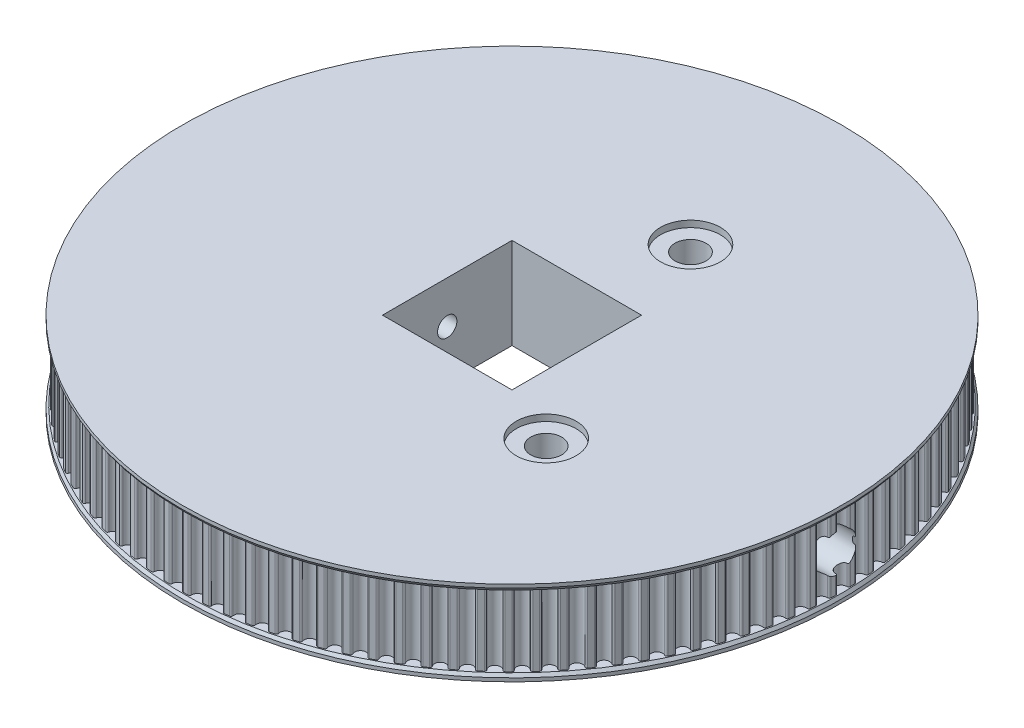
from build123d import *

# Parameters (mm, degrees)
BOSS_EXTRUDE1_DEPTH     = 11
SKETCH2_W               = 19.9
SKETCH2_H               = 19.9
CUT_EXTRUDE1_DEPTH      = 21
SKETCH3_R               = 50.63
SKETCH3_W               = 19.9
SKETCH3_H               = 19.9
BOSS_EXTRUDE3_DEPTH     = 1
BOSS_EXTRUDE4_START     = 1
SKETCH4_R               = 50.63
SKETCH4_W               = 19.9
SKETCH4_H               = 19.9
BOSS_EXTRUDE4_DEPTH     = 1
CUT_EXTRUDE2_DEPTH      = 88
CUT_EXTRUDE2_DEPTH_BACK = 65
SKETCH5_R               = 1.48
CHAMFER1_SIZE           = 0.3
CHAMFER1_SIZE2          = 0.461959489
CHAMFER2_SIZE           = 0.3
CHAMFER2_SIZE2          = 0.461959489
CUT_EXTRUDE3_START      = -8
SKETCH6_R               = 2.9
CUT_EXTRUDE3_DEPTH      = 61
CUT_EXTRUDE6_START      = -8
CUT_EXTRUDE6_DEPTH      = 61
SKETCH8_R               = 2.38
CUT_EXTRUDE7_DEPTH      = 62
SKETCH9_R               = 4.6
CUT_EXTRUDE8_DEPTH      = 1
SKETCH11_R              = 16
SKETCH11_W              = 19.9
SKETCH11_H              = 19.9
BOSS_EXTRUDE5_DEPTH     = 1


with BuildPart() as part:
    # Sketch1 → Boss-Extrude1 (new body)
    with BuildSketch(Plane(origin=(0, 0, 0), x_dir=(1, 0, 0), z_dir=(0, 1, 0))):
        with BuildLine():
            ThreePointArc((0, 48.956307929), (0.624559434, 49.220646709), (0.869589491, 49.853030887))
            ThreePointArc((0.869589491, 49.853030887), (0.944878496, 50.044121275), (1.135354899, 50.120950377))
            ThreePointArc((1.135354899, 50.120950377), (1.499776235, 50.111369655), (1.864118272, 50.099139319))
            ThreePointArc((1.864118272, 50.099139319), (2.049659046, 50.011056451), (2.113385295, 49.815805495))
            ThreePointArc((2.113385295, 49.815805495), (2.320157579, 49.169899387), (2.927790576, 48.868682491))
            ThreePointArc((2.927790576, 48.868682491), (3.567040687, 49.09519689), (3.849451373, 49.711795367))
            ThreePointArc((3.849451373, 49.711795367), (3.936033619, 49.898041133), (4.130763793, 49.963341441))
            ThreePointArc((4.130763793, 49.963341441), (4.493959895, 49.931983958), (4.856918382, 49.897986345))
            ThreePointArc((4.856918382, 49.897986345), (5.036859341, 49.798965025), (5.08879471, 49.600252448))
            ThreePointArc((5.08879471, 49.600252448), (5.256569031, 48.943136587), (5.845100422, 48.606119852))
            ThreePointArc((5.845100422, 48.606119852), (6.49675286, 48.793999008), (6.815533217, 49.392604522))
            ThreePointArc((6.815533217, 49.392604522), (6.913098763, 49.573338954), (7.111385625, 49.62687671))
            ThreePointArc((7.111385625, 49.62687671), (7.472056346, 49.573854716), (7.832331985, 49.51821153))
            ThreePointArc((7.832331985, 49.51821153), (8.006028988, 49.408606228), (8.045987561, 49.20714337))
            ThreePointArc((8.045987561, 49.20714337), (8.174163329, 48.54117006), (8.741486325, 48.16955992))
            ThreePointArc((8.741486325, 48.16955992), (9.403208343, 48.318131274), (9.757217222, 48.896600972))
            ThreePointArc((9.757217222, 48.896600972), (9.865416808, 49.071177088), (10.066550542, 49.11276064))
            ThreePointArc((10.066550542, 49.11276064), (10.423404774, 49.038263942), (10.779707873, 48.96117437))
            ThreePointArc((10.779707873, 48.96117437), (10.946539128, 48.841377445), (10.974377865, 48.63788549))
            ThreePointArc((10.974377865, 48.63788549), (11.062496245, 47.965438743), (11.606579975, 47.560565465))
            ThreePointArc((11.606579975, 47.560565465), (12.276002782, 47.66929717), (12.663972921, 48.22556028))
            ThreePointArc((12.663972921, 48.22556028), (12.782419221, 48.393353143), (12.985679821, 48.422833633))
            ThreePointArc((12.985679821, 48.422833633), (13.337440118, 48.327128909), (13.688495204, 48.228868912))
            ThreePointArc((13.688495204, 48.228868912), (13.847863499, 48.099309206), (13.863482744, 47.894516604))
            ThreePointArc((13.863482744, 47.894516604), (13.911228295, 47.218003603), (14.430125082, 46.781316529))
            ThreePointArc((14.430125082, 46.781316529), (15.104852316, 46.849819354), (15.525394884, 47.381884599))
            ThreePointArc((15.525394884, 47.381884599), (15.653663891, 47.542293554), (15.858323736, 47.55956545))
            ThreePointArc((15.858323736, 47.55956545), (16.203730888, 47.442995297), (16.548281275, 47.323916621))
            ThreePointArc((16.548281275, 47.323916621), (16.699616112, 47.185057924), (16.702959953, 46.979697778))
            ThreePointArc((16.702959953, 46.979697778), (16.710161758, 46.301540266), (17.202014086, 45.834602621))
            ThreePointArc((17.202014086, 45.834602621), (17.8796304, 45.862631343), (18.331239963, 46.368594069))
            ThreePointArc((18.331239963, 46.368594069), (18.468872506, 46.521044893), (18.674198968, 46.526046365))
            ThreePointArc((18.674198968, 46.526046365), (19.012016506, 46.389028076), (19.348828794, 46.24955699))
            ThreePointArc((19.348828794, 46.24955699), (19.491588435, 46.10189638), (19.4826449, 45.896703827))
            ThreePointArc((19.4826449, 45.896703827), (19.449277179, 45.219329431), (19.912324344, 44.723812732))
            ThreePointArc((19.912324344, 44.723812732), (20.590404046, 44.711267016), (21.07146396, 45.189316006))
            ThreePointArc((21.07146396, 45.189316006), (21.217967352, 45.333262965), (21.423225415, 45.32597611))
            ThreePointArc((21.423225415, 45.32597611), (21.75224404, 45.169000174), (22.080112527, 45.009635949))
            ThreePointArc((22.080112527, 45.009635949), (22.213785929, 44.853702013), (22.192587035, 44.649411588))
            ThreePointArc((22.192587035, 44.649411588), (22.118769235, 43.975245133), (22.551353649, 43.4529232))
            ThreePointArc((22.551353649, 43.4529232), (23.227469391, 43.399847957), (23.736257585, 43.84827192))
            ThreePointArc((23.736257585, 43.84827192), (23.891107381, 43.983199721), (24.095562274, 43.963650624))
            ThreePointArc((24.095562274, 43.963650624), (24.414604186, 43.787278973), (24.732355188, 43.608592093))
            ThreePointArc((24.732355188, 43.608592093), (24.856463835, 43.444943034), (24.823085469, 43.242286044))
            ThreePointArc((24.823085469, 43.242286044), (24.709081838, 42.57374087), (25.109654961, 42.026483481))
            ThreePointArc((25.109654961, 42.026483481), (25.781386423, 41.933068705), (26.316081568, 42.3502624))
            ThreePointArc((26.316081568, 42.3502624), (26.478723446, 42.475688037), (26.681643275, 42.443946679))
            ThreePointArc((26.681643275, 42.443946679), (26.989566386, 42.248810679), (27.296062437, 42.051440795))
            ThreePointArc((27.296062437, 42.051440795), (27.410162052, 41.880662434), (27.364723698, 41.680364339))
            ThreePointArc((27.364723698, 41.680364339), (27.210942341, 41.019833665), (27.578070225, 40.449599858))
            ThreePointArc((27.578070225, 40.449599858), (28.243012783, 40.316179951), (28.801700809, 40.700649933))
            ThreePointArc((28.801700809, 40.700649933), (28.971552553, 40.816124415), (29.172210917, 40.77230442))
            ThreePointArc((29.172210917, 40.77230442), (29.467912942, 40.559102607), (29.762056866, 40.343756253))
            ThreePointArc((29.762056866, 40.343756253), (29.865739002, 40.166459932), (29.808403319, 39.969237747))
            ThreePointArc((29.808403319, 39.969237747), (29.615394732, 39.319086101), (29.947763155, 38.727917166))
            ThreePointArc((29.947763155, 38.727917166), (30.603536488, 38.554969737), (31.184217437, 38.905339702))
            ThreePointArc((31.184217437, 38.905339702), (31.360671022, 39.01044966), (31.558349615, 38.954707893))
            ThreePointArc((31.558349615, 38.954707893), (31.840772018, 38.724203475), (32.121510856, 38.491651534))
            ThreePointArc((32.121510856, 38.491651534), (32.214404358, 38.308471928), (32.145376593, 38.115031657))
            ThreePointArc((32.145376593, 38.115031657), (31.913831697, 37.477586413), (32.210250866, 36.867598582))
            ThreePointArc((32.210250866, 36.867598582), (32.854507474, 36.655742737), (33.455102659, 36.970758453))
            ThreePointArc((33.455102659, 36.970758453), (33.637526427, 37.065127619), (33.831517612, 36.997663623))
            ThreePointArc((33.831517612, 36.997663623), (34.099649394, 36.750681744), (34.365978174, 36.501756692))
            ThreePointArc((34.365978174, 36.501756692), (34.447750507, 36.313349537), (34.367277761, 36.124383646))
            ThreePointArc((34.367277761, 36.124383646), (34.098025427, 35.501926693), (34.357434238, 34.875303564))
            ThreePointArc((34.357434238, 34.875303564), (34.987867851, 34.625297691), (35.606227297, 34.903831483))
            ThreePointArc((35.606227297, 34.903831483), (35.793968218, 34.987122042), (35.983577557, 34.908177318))
            ThreePointArc((35.983577557, 34.908177318), (36.236458875, 34.645602111), (36.487424209, 34.381195035))
            ThreePointArc((36.487424209, 34.381195035), (36.55778265, 34.188234779), (36.466152994, 34.004419717))
            ThreePointArc((36.466152994, 34.004419717), (36.160157076, 33.399179289), (36.381626912, 32.75816401))
            ThreePointArc((36.381626912, 32.75816401), (36.995980741, 32.470903066), (37.629890882, 32.711957855))
            ThreePointArc((37.629890882, 32.711957855), (37.822276892, 32.783871648), (38.006825633, 32.693728799))
            ThreePointArc((38.006825633, 32.693728799), (38.243551238, 32.416500214), (38.478254735, 32.137557623))
            ThreePointArc((38.478254735, 32.137557623), (38.536947419, 31.940735014), (38.434488864, 31.762728791))
            ThreePointArc((38.434488864, 31.762728791), (38.092844747, 31.176871492), (38.275582804, 30.52375873))
            ThreePointArc((38.275582804, 30.52375873), (38.871657622, 30.200271036), (39.518849224, 30.402983909))
            ThreePointArc((39.518849224, 30.402983909), (39.715191632, 30.463263502), (39.894019137, 30.362245216))
            ThreePointArc((39.894019137, 30.362245216), (40.113741614, 30.07135566), (40.331343096, 29.778876096))
            ThreePointArc((40.331343096, 29.778876096), (40.378159918, 29.578895707), (40.265239239, 29.407335539))
            ThreePointArc((40.265239239, 29.407335539), (39.88916992, 28.842958587), (40.032522044, 28.180086317))
            ThreePointArc((40.032522044, 28.180086317), (40.608184058, 27.821529873), (41.266340342, 27.98517517))
            ThreePointArc((41.266340342, 27.98517517), (41.465936293, 28.03360478), (41.638402407, 27.922072675))
            ThreePointArc((41.638402407, 27.922072675), (41.840335205, 27.618563457), (42.040055716, 27.313593921))
            ThreePointArc((42.040055716, 27.313593921), (42.074829084, 27.11117163), (41.951850508, 26.946671659))
            ThreePointArc((41.951850508, 26.946671659), (41.542702218, 26.405795375), (41.646155245, 25.735536508))
            ThreePointArc((41.646155245, 25.735536508), (42.199343733, 25.343194854), (42.866108672, 25.467186767))
            ThreePointArc((42.866108672, 25.467186767), (43.068243664, 25.503593027), (43.233731003, 25.381946361))
            ThreePointArc((43.233731003, 25.381946361), (43.417151255, 25.066903965), (43.598275847, 24.750536168))
            ThreePointArc((43.598275847, 24.750536168), (43.620881281, 24.546396595), (43.488285039, 24.389545687))
            ThreePointArc((43.488285039, 24.389545687), (43.047522424, 23.874106269), (43.110706019, 23.198860158))
            ThreePointArc((43.110706019, 23.198860158), (43.639440711, 22.774137775), (44.312427458, 22.858032446))
            ThreePointArc((44.312427458, 22.858032446), (44.5163779, 22.882285031), (44.674294062, 22.750959266))
            ThreePointArc((44.674294062, 22.750959266), (44.838545172, 22.425511462), (45.000425467, 22.09887792))
            ThreePointArc((45.000425467, 22.09887792), (45.010782045, 21.893751831), (44.869042797, 21.745111472))
            ThreePointArc((44.869042797, 21.745111472), (44.398243671, 21.256954059), (44.420931653, 20.579137909))
            ThreePointArc((44.420931653, 20.579137909), (44.923319816, 20.123555194), (45.600119254, 20.167052301))
            ThreePointArc((45.600119254, 20.167052301), (45.805155057, 20.179064393), (45.954934743, 20.038529642))
            ThreePointArc((45.954934743, 20.038529642), (46.099428735, 19.703841448), (46.241485242, 19.368111424))
            ThreePointArc((46.241485242, 19.368111424), (46.239555891, 19.162733118), (46.089181027, 19.022835402))
            ThreePointArc((46.089181027, 19.022835402), (45.590030729, 18.56370747), (45.572141882, 17.885747688))
            ThreePointArc((45.572141882, 17.885747688), (46.046385096, 17.400935507), (46.724574459, 17.403879342))
            ThreePointArc((46.724574459, 17.403879342), (46.929961647, 17.403607942), (47.071068685, 17.254367283))
            ThreePointArc((47.071068685, 17.254367283), (47.195288307, 16.911636796), (47.317012501, 16.568012116))
            ThreePointArc((47.317012501, 16.568012116), (47.302804128, 16.363116794), (47.144331951, 16.232462517))
            ThreePointArc((47.144331951, 16.232462517), (46.61861731, 15.804007627), (46.56021567, 15.128331132))
            ThreePointArc((46.56021567, 15.128331132), (47.004616268, 14.616024988), (47.681767813, 14.578405013))
            ThreePointArc((47.681767813, 14.578405013), (47.886771154, 14.565851091), (48.018700418, 14.408438766))
            ThreePointArc((48.018700418, 14.408438766), (48.122200995, 14.058892874), (48.223157136, 13.708603624))
            ThreePointArc((48.223157136, 13.708603624), (48.196720603, 13.504924758), (48.030718402, 13.38398163))
            ThreePointArc((48.030718402, 13.38398163), (47.48032134, 12.987733538), (47.38161597, 12.316759077))
            ThreePointArc((47.38161597, 12.316759077), (47.794583113, 11.778792892), (48.468272814, 11.700743777))
            ThreePointArc((48.468272814, 11.700743777), (48.672158449, 11.675952274), (48.794437665, 11.510931778))
            ThreePointArc((48.794437665, 11.510931778), (48.876848694, 11.155821763), (48.956675384, 10.800121889))
            ThreePointArc((48.956675384, 10.800121889), (48.918105326, 10.598388597), (48.745167347, 10.487589563))
            ThreePointArc((48.745167347, 10.487589563), (48.172058142, 10.124966733), (48.033402382, 9.461096221))
            ThreePointArc((48.033402382, 9.461096221), (48.413457755, 8.899395775), (49.081273977, 8.781196915))
            ThreePointArc((49.081273977, 8.781196915), (49.283312049, 8.744256578), (49.39550349, 8.572218643))
            ThreePointArc((49.39550349, 8.572218643), (49.45652996, 8.212815706), (49.51494144, 7.852978521))
            ThreePointArc((49.51494144, 7.852978521), (49.464375929, 7.653912955), (49.285121243, 7.553654646))
            ThreePointArc((49.285121243, 7.553654646), (48.691351478, 7.225955176), (48.513241679, 6.571565096))
            ThreePointArc((48.513241679, 6.571565096), (48.859024783, 5.988141131), (49.518576918, 5.830215648))
            ThreePointArc((49.518576918, 5.830215648), (49.718044182, 5.781258713), (49.819746232, 5.602819189))
            ThreePointArc((49.819746232, 5.602819189), (49.859169684, 5.240409901), (49.895956857, 4.877723528))
            ThreePointArc((49.895956857, 4.877723528), (49.833576904, 4.682038291), (49.648647197, 4.592679607))
            ThreePointArc((49.648647197, 4.592679607), (49.036342413, 4.301076574), (48.819416163, 3.658509473))
            ThreePointArc((48.819416163, 3.658509473), (49.129689183, 3.055450496), (49.778616205, 2.858363721))
            ThreePointArc((49.778616205, 2.858363721), (49.974798621, 2.797565442), (50.065647212, 2.613363096))
            ThreePointArc((50.065647212, 2.613363096), (50.083326521, 2.249244788), (50.098357698, 1.885007551))
            ThreePointArc((50.098357698, 1.885007551), (50.024386607, 1.693403145), (49.83444388, 1.615263966))
            ThreePointArc((49.83444388, 1.615263966), (49.205795969, 1.360801235), (48.950829807, 0.732357336))
            ThreePointArc((48.950829807, 0.732357336), (49.224482047, 0.111822141), (49.860460966, -0.123720406))
            ThreePointArc((49.860460966, -0.123720406), (50.052656251, -0.196142387), (50.13232617, -0.385448158))
            ThreePointArc((50.13232617, -0.385448158), (50.128198047, -0.749972038), (50.12141942, -1.114456264))
            ThreePointArc((50.12141942, -1.114456264), (50.036121988, -1.301293944), (49.841846187, -1.367933901))
            ThreePointArc((49.841846187, -1.367933901), (49.199105546, -1.58434542), (48.907012185, -2.19641645))
            ThreePointArc((48.907012185, -2.19641645), (49.14306404, -2.832206509), (49.763818217, -3.105361646))
            ThreePointArc((49.763818217, -3.105361646), (49.951338362, -3.189148078), (50.019544411, -3.382879608))
            ThreePointArc((50.019544411, -3.382879608), (49.993623634, -3.746504158), (49.96505947, -4.109930615))
            ThreePointArc((49.96505947, -4.109930615), (49.86874104, -4.291332739), (49.670827621, -4.346234919))
            ThreePointArc((49.670827621, -4.346234919), (49.016295094, -4.523820529), (48.688120152, -5.117327635))
            ThreePointArc((48.688120152, -5.117327635), (48.885726619, -5.766096594), (49.489033914, -6.075886497))
            ThreePointArc((49.489033914, -6.075886497), (49.671207645, -6.170737446), (49.727705664, -6.368201226))
            ThreePointArc((49.727705664, -6.368201226), (49.680085024, -6.729624766), (49.629837574, -7.090692481))
            ThreePointArc((49.629837574, -7.090692481), (49.522842941, -7.266009677), (49.322000383, -7.308977544))
            ThreePointArc((49.322000383, -7.308977544), (48.658019027, -7.447101535), (48.294937285, -8.019920116))
            ThreePointArc((48.294937285, -8.019920116), (48.453390983, -8.679345549), (49.037091714, -9.024661251))
            ThreePointArc((49.037091714, -9.024661251), (49.213266897, -9.130237175), (49.257854638, -9.330726337))
            ThreePointArc((49.257854638, -9.330726337), (49.188704603, -9.688655064), (49.11695374, -10.046071508))
            ThreePointArc((49.11695374, -10.046071508), (48.999665917, -10.214676185), (48.796613184, -10.245555926))
            ThreePointArc((48.796613184, -10.245555926), (48.125559881, -10.343723851), (47.728871077, -10.893803363))
            ThreePointArc((47.728871077, -10.893803363), (47.847604784, -11.561524701), (48.409609453, -11.941130061))
            ThreePointArc((48.409609453, -11.941130061), (48.579155426, -12.057053025), (48.611673276, -12.25984987))
            ThreePointArc((48.611673276, -12.25984987), (48.521241386, -12.613002491), (48.42824396, -12.965488206))
            ThreePointArc((48.42824396, -12.965488206), (48.301082807, -13.126776804), (48.096546775, -13.145457878))
            ThreePointArc((48.096546775, -13.145457878), (47.42082372, -13.203318319), (46.991947899, -13.728689623))
            ThreePointArc((46.991947899, -13.728689623), (47.070536577, -14.402316594), (47.608833353, -14.814852724))
            ThreePointArc((47.608833353, -14.814852724), (47.771143187, -14.940707754), (47.79147474, -15.145086321))
            ThreePointArc((47.79147474, -15.145086321), (47.680084718, -15.492198643), (47.566173635, -15.838491822))
            ThreePointArc((47.566173635, -15.838491822), (47.429594356, -15.991886969), (47.224307211, -15.998302501))
            ThreePointArc((47.224307211, -15.998302501), (46.546333318, -16.015648335), (46.086805742, -16.514430736))
            ThreePointArc((46.086805742, -16.514430736), (46.124968066, -17.191551932), (46.637629987, -17.635542059))
            ThreePointArc((46.637629987, -17.635542059), (46.792122653, -17.770878628), (46.800195128, -17.976107295))
            ThreePointArc((46.800195128, -17.976107295), (46.668245721, -18.315936744), (46.533828754, -18.654797748))
            ThreePointArc((46.533828754, -18.654797748), (46.388320266, -18.799750329), (46.183016884, -18.793877354))
            ThreePointArc((46.183016884, -18.793877354), (45.505219123, -18.770646486), (45.016684782, -19.241054474))
            ThreePointArc((45.016684782, -19.241054474), (45.014284141, -19.919245976), (45.499476009, -20.39310073))
            ThreePointArc((45.499476009, -20.39310073), (45.645598464, -20.537434367), (45.641382964, -20.74277847))
            ThreePointArc((45.641382964, -20.74277847), (45.489346516, -21.074108546), (45.334904842, -21.404324339))
            ThreePointArc((45.334904842, -21.404324339), (45.18098803, -21.540315462), (44.976403342, -21.522175004))
            ThreePointArc((44.976403342, -21.522175004), (44.301208054, -21.458450594), (43.785415775, -21.89880023))
            ThreePointArc((43.785415775, -21.89880023), (43.742460761, -22.575634289), (44.198445716, -23.077657394))
            ThreePointArc((44.198445716, -23.077657394), (44.33567488, -23.230471422), (44.319186494, -23.435195881))
            ThreePointArc((44.319186494, -23.435195881), (44.147607257, -23.756840508), (43.973693738, -24.077229004))
            ThreePointArc((43.973693738, -24.077229004), (43.811919583, -24.203771856), (43.608785949, -24.173428853))
            ThreePointArc((43.608785949, -24.173428853), (42.938610158, -24.069439019), (42.397406342, -24.478153965))
            ThreePointArc((42.397406342, -24.478153965), (42.314050724, -25.151207691), (42.739196458, -25.679602034))
            ThreePointArc((42.739196458, -25.679602034), (42.867041086, -25.840349419), (42.838338839, -26.043721373))
            ThreePointArc((42.838338839, -26.043721373), (42.647831022, -26.354529147), (42.455068223, -26.663943438))
            ThreePointArc((42.455068223, -26.663943438), (42.286015834, -26.780585029), (42.085060421, -26.738148101))
            ThreePointArc((42.085060421, -26.738148101), (41.422303181, -26.594265098), (40.857625199, -26.969882261))
            ThreePointArc((40.857625199, -26.969882261), (40.734167367, -27.636746296), (41.126951969, -28.189620363))
            ThreePointArc((41.126951969, -28.189620363), (41.244954411, -28.357725671), (41.204141049, -28.559017102))
            ThreePointArc((41.204141049, -28.559017102), (40.995386621, -28.857875412), (40.784464582, -29.155207876))
            ThreePointArc((40.784464582, -29.155207876), (40.608739123, -29.261530657), (40.410681299, -29.207151717))
            ThreePointArc((40.410681299, -29.207151717), (39.75771511, -29.023890611), (39.171584361, -29.365065379))
            ThreePointArc((39.171584361, -29.365065379), (39.008466264, -30.023352523), (39.367483666, -30.598727168))
            ThreePointArc((39.367483666, -30.598727168), (39.475221503, -30.773588625), (39.422443129, -30.972078962))
            ThreePointArc((39.422443129, -30.972078962), (39.196189375, -31.257917972), (38.967863142, -31.542104235))
            ThreePointArc((38.967863142, -31.542104235), (38.786093666, -31.637727601), (38.591642426, -31.571601311))
            ThreePointArc((38.591642426, -31.571601311), (37.950804737, -31.349618128), (37.345319418, -31.655129184))
            ThreePointArc((37.345319418, -31.655129184), (37.143124975, -32.302482939), (37.467089989, -32.89829847))
            ThreePointArc((37.467089989, -32.89829847), (37.564177548, -33.079290119), (37.499623093, -33.274268818))
            ThreePointArc((37.499623093, -33.274268818), (37.256679944, -33.546065299), (37.011766867, -33.816088048))
            ThreePointArc((37.011766867, -33.816088048), (36.824604059, -33.90066969), (36.634455489, -33.823032767))
            ThreePointArc((36.634455489, -33.823032767), (36.008040333, -33.563122149), (35.385367923, -33.831875842))
            ThreePointArc((35.385367923, -33.831875842), (35.144820939, -34.465978851), (35.432573854, -35.080102403))
            ThreePointArc((35.432573854, -35.080102403), (35.518663586, -35.266576339), (35.442564139, -35.457345427))
            ThreePointArc((35.442564139, -35.457345427), (35.183801268, -35.714126418), (34.923178072, -35.969019042))
            ThreePointArc((34.923178072, -35.969019042), (34.731291928, -36.042256181), (34.546126709, -35.953386543))
            ThreePointArc((34.546126709, -35.953386543), (33.936376489, -35.656478903), (33.298745995, -35.887513165))
            ThreePointArc((33.298745995, -35.887513165), (33.020707565, -36.506095503), (33.2712183, -37.136328673))
            ThreePointArc((33.2712183, -37.136328673), (33.346002027, -37.327617369), (33.258630004, -37.513493942))
            ThreePointArc((33.258630004, -37.513493942), (32.984973715, -37.754340234), (32.709573363, -37.993190283))
            ThreePointArc((32.709573363, -37.993190283), (32.513650785, -38.054820749), (32.334131761, -37.955036527))
            ThreePointArc((32.334131761, -37.955036527), (31.743229226, -37.622194716), (31.092923199, -37.814682505))
            ThreePointArc((31.092923199, -37.814682505), (30.778388628, -38.415529808), (30.99076042, -39.059616525))
            ThreePointArc((30.99076042, -39.059616525), (31.053970435, -39.255035216), (30.955638606, -39.435353884))
            ThreePointArc((30.955638606, -39.435353884), (30.668068517, -39.65940331), (30.37887687, -39.881355764))
            ThreePointArc((30.37887687, -39.881355764), (30.179619211, -39.931158935), (30.006389014, -39.82081733))
            ThreePointArc((30.006389014, -39.82081733), (29.43644944, -39.453232837), (28.775795807, -39.606485097))
            ThreePointArc((28.775795807, -39.606485097), (28.425891048, -40.187446486), (28.599363661, -40.843081087))
            ThreePointArc((28.599363661, -40.843081087), (28.650773688, -41.041930226), (28.541834055, -41.216045495))
            ThreePointArc((28.541834055, -41.216045495), (28.241379594, -41.422496015), (27.939431883, -41.626756341))
            ThreePointArc((27.939431883, -41.626756341), (27.737552433, -41.664553935), (27.571231182, -41.544049942))
            ThreePointArc((27.571231182, -41.544049942), (27.024294805, -41.143038624), (26.355658535, -41.25650675))
            ThreePointArc((26.355658535, -41.25650675), (25.971636155, -41.815502536), (26.105588602, -42.480338019))
            ThreePointArc((26.105588602, -42.480338019), (26.145014608, -42.681905777), (26.025857146, -42.84919436))
            ThreePointArc((26.025857146, -42.84919436), (25.71359386, -43.037306935), (25.399970981, -43.223143935))
            ThreePointArc((25.399970981, -43.223143935), (25.196192416, -43.248800646), (25.037375498, -43.118565638))
            ThreePointArc((25.037375498, -43.118565638), (24.515400209, -42.685563011), (23.841174846, -42.758840817))
            ThreePointArc((23.841174846, -42.758840817), (23.424409546, -43.29386994), (23.518362312, -43.965526366))
            ThreePointArc((23.518362312, -43.965526366), (23.545663161, -44.169091183), (23.416714423, -44.32895423))
            ThreePointArc((23.416714423, -44.32895423), (23.093760135, -44.498055467), (22.769584776, -44.664803891))
            ThreePointArc((22.769584776, -44.664803891), (22.564636569, -44.678227875), (22.413892507, -44.53872806))
            ThreePointArc((22.413892507, -44.53872806), (21.918746842, -44.07528416), (21.241345938, -44.108109332))
            ThreePointArc((21.241345938, -44.108109332), (20.79332963, -44.617256526), (20.846946388, -45.29332954))
            ThreePointArc((20.846946388, -45.29332954), (20.86202435, -45.498162705), (20.72374594, -45.650027948))
            ThreePointArc((20.72374594, -45.650027948), (20.391256742, -45.799512508), (20.057689366, -45.946575441))
            ThreePointArc((20.057689366, -45.946575441), (19.85230518, -45.947718644), (19.710173599, -45.799453394))
            ThreePointArc((19.710173599, -45.799453394), (19.243630051, -45.307227232), (18.565478524, -45.299482262))
            ThreePointArc((18.565478524, -45.299482262), (18.08781499, -45.780924912), (18.100903807, -46.458994349))
            ThreePointArc((18.100903807, -46.458994349), (18.103704907, -46.664362614), (17.956591825, -46.807686415))
            ThreePointArc((17.956591825, -46.807686415), (17.615757942, -46.937019181), (17.273992634, -47.063870176))
            ThreePointArc((17.273992634, -47.063870176), (17.06890769, -47.052728506), (16.935897384, -46.896228572))
            ThreePointArc((16.935897384, -46.896228572), (16.499626058, -46.376982188), (15.823151516, -46.328694803))
            ThreePointArc((15.823151516, -46.328694803), (15.317550667, -46.78070947), (15.290064688, -47.458348015))
            ThreePointArc((15.290064688, -47.458348015), (15.280578899, -47.663516216), (15.125157772, -47.797785512))
            ThreePointArc((15.125157772, -47.797785512), (14.7771993, -47.906503508), (14.428459491, -48.012688471))
            ThreePointArc((14.428459491, -48.012688471), (14.224407942, -47.989301811), (14.100995053, -47.825127423))
            ThreePointArc((14.100995053, -47.825127423), (13.696557686, -47.280719585), (13.024181732, -47.19206264))
            ThreePointArc((13.024181732, -47.19206264), (12.492453489, -47.613031229), (12.424491105, -48.287813113))
            ThreePointArc((12.424491105, -48.287813113), (12.402752385, -48.4920468), (12.239579579, -48.616780942))
            ThreePointArc((12.239579579, -48.616780942), (11.88574212, -48.704494985), (11.531276208, -48.789633801))
            ThreePointArc((11.531276208, -48.789633801), (11.328988504, -48.75408587), (11.215614819, -48.58282473))
            ThreePointArc((11.215614819, -48.58282473), (10.844459192, -48.015204277), (10.178588758, -47.886495142))
            ThreePointArc((10.178588758, -47.886495142), (9.622636569, -48.274910693), (9.514441069, -48.944420373))
            ThreePointArc((9.514441069, -48.944420373), (9.480527236, -49.146988442), (9.310186868, -49.261740915))
            ThreePointArc((9.310186868, -49.261740915), (8.951737068, -49.328137011), (8.59281395, -49.391924906))
            ThreePointArc((8.59281395, -49.391924906), (8.393014228, -49.344342956), (8.290085594, -49.166608133))
            ThreePointArc((8.290085594, -49.166608133), (7.953540349, -48.577806999), (7.296559077, -48.409506419))
            ThreePointArc((7.296559077, -48.409506419), (6.718373107, -48.763978506), (6.570331804, -49.42581931))
            ThreePointArc((6.570331804, -49.42581931), (6.524364259, -49.625996621), (6.347466105, -49.73035664))
            ThreePointArc((6.347466105, -49.73035664), (5.985687121, -49.775197108), (5.623591647, -49.817405738))
            ThreePointArc((5.623591647, -49.817405738), (5.426995139, -49.7579601), (5.334880015, -49.57438784))
            ThreePointArc((5.334880015, -49.57438784), (5.034149896, -48.96651378), (4.388409609, -48.759224226))
            ThreePointArc((4.388409609, -48.759224226), (3.790059613, -49.078483932), (3.602702456, -49.730286642))
            ThreePointArc((3.602702456, -49.730286642), (3.544845752, -49.927356611), (3.36202306, -50.020950595))
            ThreePointArc((3.36202306, -50.020950595), (2.998209967, -50.044074919), (2.634238346, -50.064553187))
            ThreePointArc((2.634238346, -50.064553187), (2.441548816, -49.993456661), (2.36057695, -49.804704105))
            ThreePointArc((2.36057695, -49.804704105), (2.096738493, -49.17993315), (1.464550774, -48.934396666))
            ThreePointArc((1.464550774, -48.934396666), (0.84817869, -49.217301123), (0.622176368, -49.856732455))
            ThreePointArc((0.622176368, -49.856732455), (0.552637618, -50.049989623), (0.364544845, -50.132482529))
            ThreePointArc((0.364544845, -50.132482529), (0, -50.133807929), (-0.364544845, -50.132482529))
            ThreePointArc((-0.364544845, -50.132482529), (-0.552637618, -50.049989623), (-0.622176368, -49.856732455))
            ThreePointArc((-0.622176368, -49.856732455), (-0.84817869, -49.217301123), (-1.464550774, -48.934396666))
            ThreePointArc((-1.464550774, -48.934396666), (-2.096738493, -49.17993315), (-2.36057695, -49.804704105))
            ThreePointArc((-2.36057695, -49.804704105), (-2.441548816, -49.993456661), (-2.634238346, -50.064553187))
            ThreePointArc((-2.634238346, -50.064553187), (-2.998209967, -50.044074919), (-3.36202306, -50.020950595))
            ThreePointArc((-3.36202306, -50.020950595), (-3.544845752, -49.927356611), (-3.602702456, -49.730286642))
            ThreePointArc((-3.602702456, -49.730286642), (-3.790059613, -49.078483932), (-4.388409609, -48.759224226))
            ThreePointArc((-4.388409609, -48.759224226), (-5.034149896, -48.96651378), (-5.334880015, -49.57438784))
            ThreePointArc((-5.334880015, -49.57438784), (-5.426995139, -49.7579601), (-5.623591647, -49.817405738))
            ThreePointArc((-5.623591647, -49.817405738), (-5.985687121, -49.775197108), (-6.347466105, -49.73035664))
            ThreePointArc((-6.347466105, -49.73035664), (-6.524364259, -49.625996621), (-6.570331804, -49.42581931))
            ThreePointArc((-6.570331804, -49.42581931), (-6.718373107, -48.763978506), (-7.296559077, -48.409506419))
            ThreePointArc((-7.296559077, -48.409506419), (-7.953540349, -48.577806999), (-8.290085594, -49.166608133))
            ThreePointArc((-8.290085594, -49.166608133), (-8.393014228, -49.344342956), (-8.59281395, -49.391924906))
            ThreePointArc((-8.59281395, -49.391924906), (-8.951737068, -49.328137011), (-9.310186868, -49.261740915))
            ThreePointArc((-9.310186868, -49.261740915), (-9.480527236, -49.146988442), (-9.514441069, -48.944420373))
            ThreePointArc((-9.514441069, -48.944420373), (-9.622636569, -48.274910693), (-10.178588758, -47.886495142))
            ThreePointArc((-10.178588758, -47.886495142), (-10.844459192, -48.015204277), (-11.215614819, -48.58282473))
            ThreePointArc((-11.215614819, -48.58282473), (-11.328988504, -48.75408587), (-11.531276208, -48.789633801))
            ThreePointArc((-11.531276208, -48.789633801), (-11.88574212, -48.704494985), (-12.239579579, -48.616780942))
            ThreePointArc((-12.239579579, -48.616780942), (-12.402752385, -48.4920468), (-12.424491105, -48.287813113))
            ThreePointArc((-12.424491105, -48.287813113), (-12.492453489, -47.613031229), (-13.024181732, -47.19206264))
            ThreePointArc((-13.024181732, -47.19206264), (-13.696557686, -47.280719585), (-14.100995053, -47.825127423))
            ThreePointArc((-14.100995053, -47.825127423), (-14.224407942, -47.989301811), (-14.428459491, -48.012688471))
            ThreePointArc((-14.428459491, -48.012688471), (-14.7771993, -47.906503508), (-15.125157772, -47.797785512))
            ThreePointArc((-15.125157772, -47.797785512), (-15.280578899, -47.663516216), (-15.290064688, -47.458348015))
            ThreePointArc((-15.290064688, -47.458348015), (-15.317550667, -46.78070947), (-15.823151516, -46.328694803))
            ThreePointArc((-15.823151516, -46.328694803), (-16.499626058, -46.376982188), (-16.935897384, -46.896228572))
            ThreePointArc((-16.935897384, -46.896228572), (-17.06890769, -47.052728506), (-17.273992634, -47.063870176))
            ThreePointArc((-17.273992634, -47.063870176), (-17.615757942, -46.937019181), (-17.956591825, -46.807686415))
            ThreePointArc((-17.956591825, -46.807686415), (-18.103704907, -46.664362614), (-18.100903807, -46.458994349))
            ThreePointArc((-18.100903807, -46.458994349), (-18.08781499, -45.780924912), (-18.565478524, -45.299482262))
            ThreePointArc((-18.565478524, -45.299482262), (-19.243630051, -45.307227232), (-19.710173599, -45.799453394))
            ThreePointArc((-19.710173599, -45.799453394), (-19.85230518, -45.947718644), (-20.057689366, -45.946575441))
            ThreePointArc((-20.057689366, -45.946575441), (-20.391256742, -45.799512508), (-20.72374594, -45.650027948))
            ThreePointArc((-20.72374594, -45.650027948), (-20.86202435, -45.498162705), (-20.846946388, -45.29332954))
            ThreePointArc((-20.846946388, -45.29332954), (-20.79332963, -44.617256526), (-21.241345938, -44.108109332))
            ThreePointArc((-21.241345938, -44.108109332), (-21.918746842, -44.07528416), (-22.413892507, -44.53872806))
            ThreePointArc((-22.413892507, -44.53872806), (-22.564636569, -44.678227875), (-22.769584776, -44.664803891))
            ThreePointArc((-22.769584776, -44.664803891), (-23.093760135, -44.498055467), (-23.416714423, -44.32895423))
            ThreePointArc((-23.416714423, -44.32895423), (-23.545663161, -44.169091183), (-23.518362312, -43.965526366))
            ThreePointArc((-23.518362312, -43.965526366), (-23.424409546, -43.29386994), (-23.841174846, -42.758840817))
            ThreePointArc((-23.841174846, -42.758840817), (-24.515400209, -42.685563011), (-25.037375498, -43.118565638))
            ThreePointArc((-25.037375498, -43.118565638), (-25.196192416, -43.248800646), (-25.399970981, -43.223143935))
            ThreePointArc((-25.399970981, -43.223143935), (-25.71359386, -43.037306935), (-26.025857146, -42.84919436))
            ThreePointArc((-26.025857146, -42.84919436), (-26.145014608, -42.681905777), (-26.105588602, -42.480338019))
            ThreePointArc((-26.105588602, -42.480338019), (-25.971636155, -41.815502536), (-26.355658535, -41.25650675))
            ThreePointArc((-26.355658535, -41.25650675), (-27.024294805, -41.143038624), (-27.571231182, -41.544049942))
            ThreePointArc((-27.571231182, -41.544049942), (-27.737552433, -41.664553935), (-27.939431883, -41.626756341))
            ThreePointArc((-27.939431883, -41.626756341), (-28.241379594, -41.422496015), (-28.541834055, -41.216045495))
            ThreePointArc((-28.541834055, -41.216045495), (-28.650773688, -41.041930226), (-28.599363661, -40.843081087))
            ThreePointArc((-28.599363661, -40.843081087), (-28.425891048, -40.187446486), (-28.775795807, -39.606485097))
            ThreePointArc((-28.775795807, -39.606485097), (-29.43644944, -39.453232837), (-30.006389014, -39.82081733))
            ThreePointArc((-30.006389014, -39.82081733), (-30.179619211, -39.931158935), (-30.37887687, -39.881355764))
            ThreePointArc((-30.37887687, -39.881355764), (-30.668068517, -39.65940331), (-30.955638606, -39.435353884))
            ThreePointArc((-30.955638606, -39.435353884), (-31.053970435, -39.255035216), (-30.99076042, -39.059616525))
            ThreePointArc((-30.99076042, -39.059616525), (-30.778388628, -38.415529808), (-31.092923199, -37.814682505))
            ThreePointArc((-31.092923199, -37.814682505), (-31.743229226, -37.622194716), (-32.334131761, -37.955036527))
            ThreePointArc((-32.334131761, -37.955036527), (-32.513650785, -38.054820749), (-32.709573363, -37.993190283))
            ThreePointArc((-32.709573363, -37.993190283), (-32.984973715, -37.754340234), (-33.258630004, -37.513493942))
            ThreePointArc((-33.258630004, -37.513493942), (-33.346002027, -37.327617369), (-33.2712183, -37.136328673))
            ThreePointArc((-33.2712183, -37.136328673), (-33.020707565, -36.506095503), (-33.298745995, -35.887513165))
            ThreePointArc((-33.298745995, -35.887513165), (-33.936376489, -35.656478903), (-34.546126709, -35.953386543))
            ThreePointArc((-34.546126709, -35.953386543), (-34.731291928, -36.042256181), (-34.923178072, -35.969019042))
            ThreePointArc((-34.923178072, -35.969019042), (-35.183801268, -35.714126418), (-35.442564139, -35.457345427))
            ThreePointArc((-35.442564139, -35.457345427), (-35.518663586, -35.266576339), (-35.432573854, -35.080102403))
            ThreePointArc((-35.432573854, -35.080102403), (-35.144820939, -34.465978851), (-35.385367923, -33.831875842))
            ThreePointArc((-35.385367923, -33.831875842), (-36.008040333, -33.563122149), (-36.634455489, -33.823032767))
            ThreePointArc((-36.634455489, -33.823032767), (-36.824604059, -33.90066969), (-37.011766867, -33.816088048))
            ThreePointArc((-37.011766867, -33.816088048), (-37.256679944, -33.546065299), (-37.499623093, -33.274268818))
            ThreePointArc((-37.499623093, -33.274268818), (-37.564177548, -33.079290119), (-37.467089989, -32.89829847))
            ThreePointArc((-37.467089989, -32.89829847), (-37.143124975, -32.302482939), (-37.345319418, -31.655129184))
            ThreePointArc((-37.345319418, -31.655129184), (-37.950804737, -31.349618128), (-38.591642426, -31.571601311))
            ThreePointArc((-38.591642426, -31.571601311), (-38.786093666, -31.637727601), (-38.967863142, -31.542104235))
            ThreePointArc((-38.967863142, -31.542104235), (-39.196189375, -31.257917972), (-39.422443129, -30.972078962))
            ThreePointArc((-39.422443129, -30.972078962), (-39.475221503, -30.773588625), (-39.367483666, -30.598727168))
            ThreePointArc((-39.367483666, -30.598727168), (-39.008466264, -30.023352523), (-39.171584361, -29.365065379))
            ThreePointArc((-39.171584361, -29.365065379), (-39.75771511, -29.023890611), (-40.410681299, -29.207151717))
            ThreePointArc((-40.410681299, -29.207151717), (-40.608739123, -29.261530657), (-40.784464582, -29.155207876))
            ThreePointArc((-40.784464582, -29.155207876), (-40.995386621, -28.857875412), (-41.204141049, -28.559017102))
            ThreePointArc((-41.204141049, -28.559017102), (-41.244954411, -28.357725671), (-41.126951969, -28.189620363))
            ThreePointArc((-41.126951969, -28.189620363), (-40.734167367, -27.636746296), (-40.857625199, -26.969882261))
            ThreePointArc((-40.857625199, -26.969882261), (-41.422303181, -26.594265098), (-42.085060421, -26.738148101))
            ThreePointArc((-42.085060421, -26.738148101), (-42.286015834, -26.780585029), (-42.455068223, -26.663943438))
            ThreePointArc((-42.455068223, -26.663943438), (-42.647831022, -26.354529147), (-42.838338839, -26.043721373))
            ThreePointArc((-42.838338839, -26.043721373), (-42.867041086, -25.840349419), (-42.739196458, -25.679602034))
            ThreePointArc((-42.739196458, -25.679602034), (-42.314050724, -25.151207691), (-42.397406342, -24.478153965))
            ThreePointArc((-42.397406342, -24.478153965), (-42.938610158, -24.069439019), (-43.608785949, -24.173428853))
            ThreePointArc((-43.608785949, -24.173428853), (-43.811919583, -24.203771856), (-43.973693738, -24.077229004))
            ThreePointArc((-43.973693738, -24.077229004), (-44.147607257, -23.756840508), (-44.319186494, -23.435195881))
            ThreePointArc((-44.319186494, -23.435195881), (-44.33567488, -23.230471422), (-44.198445716, -23.077657394))
            ThreePointArc((-44.198445716, -23.077657394), (-43.742460761, -22.575634289), (-43.785415775, -21.89880023))
            ThreePointArc((-43.785415775, -21.89880023), (-44.301208054, -21.458450594), (-44.976403342, -21.522175004))
            ThreePointArc((-44.976403342, -21.522175004), (-45.18098803, -21.540315462), (-45.334904842, -21.404324339))
            ThreePointArc((-45.334904842, -21.404324339), (-45.489346516, -21.074108546), (-45.641382964, -20.74277847))
            ThreePointArc((-45.641382964, -20.74277847), (-45.645598464, -20.537434367), (-45.499476009, -20.39310073))
            ThreePointArc((-45.499476009, -20.39310073), (-45.014284141, -19.919245976), (-45.016684782, -19.241054474))
            ThreePointArc((-45.016684782, -19.241054474), (-45.505219123, -18.770646486), (-46.183016884, -18.793877354))
            ThreePointArc((-46.183016884, -18.793877354), (-46.388320266, -18.799750329), (-46.533828754, -18.654797748))
            ThreePointArc((-46.533828754, -18.654797748), (-46.668245721, -18.315936744), (-46.800195128, -17.976107295))
            ThreePointArc((-46.800195128, -17.976107295), (-46.792122653, -17.770878628), (-46.637629987, -17.635542059))
            ThreePointArc((-46.637629987, -17.635542059), (-46.124968066, -17.191551932), (-46.086805742, -16.514430736))
            ThreePointArc((-46.086805742, -16.514430736), (-46.546333318, -16.015648335), (-47.224307211, -15.998302501))
            ThreePointArc((-47.224307211, -15.998302501), (-47.429594356, -15.991886969), (-47.566173635, -15.838491822))
            ThreePointArc((-47.566173635, -15.838491822), (-47.680084718, -15.492198643), (-47.79147474, -15.145086321))
            ThreePointArc((-47.79147474, -15.145086321), (-47.771143187, -14.940707754), (-47.608833353, -14.814852724))
            ThreePointArc((-47.608833353, -14.814852724), (-47.070536577, -14.402316594), (-46.991947899, -13.728689623))
            ThreePointArc((-46.991947899, -13.728689623), (-47.42082372, -13.203318319), (-48.096546775, -13.145457878))
            ThreePointArc((-48.096546775, -13.145457878), (-48.301082807, -13.126776804), (-48.42824396, -12.965488206))
            ThreePointArc((-48.42824396, -12.965488206), (-48.521241386, -12.613002491), (-48.611673276, -12.25984987))
            ThreePointArc((-48.611673276, -12.25984987), (-48.579155426, -12.057053025), (-48.409609453, -11.941130061))
            ThreePointArc((-48.409609453, -11.941130061), (-47.847604784, -11.561524701), (-47.728871077, -10.893803363))
            ThreePointArc((-47.728871077, -10.893803363), (-48.125559881, -10.343723851), (-48.796613184, -10.245555926))
            ThreePointArc((-48.796613184, -10.245555926), (-48.999665917, -10.214676185), (-49.11695374, -10.046071508))
            ThreePointArc((-49.11695374, -10.046071508), (-49.188704603, -9.688655064), (-49.257854638, -9.330726337))
            ThreePointArc((-49.257854638, -9.330726337), (-49.213266897, -9.130237175), (-49.037091714, -9.024661251))
            ThreePointArc((-49.037091714, -9.024661251), (-48.453390983, -8.679345549), (-48.294937285, -8.019920116))
            ThreePointArc((-48.294937285, -8.019920116), (-48.658019027, -7.447101535), (-49.322000383, -7.308977544))
            ThreePointArc((-49.322000383, -7.308977544), (-49.522842941, -7.266009677), (-49.629837574, -7.090692481))
            ThreePointArc((-49.629837574, -7.090692481), (-49.680085024, -6.729624766), (-49.727705664, -6.368201226))
            ThreePointArc((-49.727705664, -6.368201226), (-49.671207645, -6.170737446), (-49.489033914, -6.075886497))
            ThreePointArc((-49.489033914, -6.075886497), (-48.885726619, -5.766096594), (-48.688120152, -5.117327635))
            ThreePointArc((-48.688120152, -5.117327635), (-49.016295094, -4.523820529), (-49.670827621, -4.346234919))
            ThreePointArc((-49.670827621, -4.346234919), (-49.86874104, -4.291332739), (-49.96505947, -4.109930615))
            ThreePointArc((-49.96505947, -4.109930615), (-49.993623634, -3.746504158), (-50.019544411, -3.382879608))
            ThreePointArc((-50.019544411, -3.382879608), (-49.951338362, -3.189148078), (-49.763818217, -3.105361646))
            ThreePointArc((-49.763818217, -3.105361646), (-49.14306404, -2.832206509), (-48.907012185, -2.19641645))
            ThreePointArc((-48.907012185, -2.19641645), (-49.199105546, -1.58434542), (-49.841846187, -1.367933901))
            ThreePointArc((-49.841846187, -1.367933901), (-50.036121988, -1.301293944), (-50.12141942, -1.114456264))
            ThreePointArc((-50.12141942, -1.114456264), (-50.128198047, -0.749972038), (-50.13232617, -0.385448158))
            ThreePointArc((-50.13232617, -0.385448158), (-50.052656251, -0.196142387), (-49.860460966, -0.123720406))
            ThreePointArc((-49.860460966, -0.123720406), (-49.224482047, 0.111822141), (-48.950829807, 0.732357336))
            ThreePointArc((-48.950829807, 0.732357336), (-49.205795969, 1.360801235), (-49.83444388, 1.615263966))
            ThreePointArc((-49.83444388, 1.615263966), (-50.024386607, 1.693403145), (-50.098357698, 1.885007551))
            ThreePointArc((-50.098357698, 1.885007551), (-50.083326521, 2.249244788), (-50.065647212, 2.613363096))
            ThreePointArc((-50.065647212, 2.613363096), (-49.974798621, 2.797565442), (-49.778616205, 2.858363721))
            ThreePointArc((-49.778616205, 2.858363721), (-49.129689183, 3.055450496), (-48.819416163, 3.658509473))
            ThreePointArc((-48.819416163, 3.658509473), (-49.036342413, 4.301076574), (-49.648647197, 4.592679607))
            ThreePointArc((-49.648647197, 4.592679607), (-49.833576904, 4.682038291), (-49.895956857, 4.877723528))
            ThreePointArc((-49.895956857, 4.877723528), (-49.859169684, 5.240409901), (-49.819746232, 5.602819189))
            ThreePointArc((-49.819746232, 5.602819189), (-49.718044182, 5.781258713), (-49.518576918, 5.830215648))
            ThreePointArc((-49.518576918, 5.830215648), (-48.859024783, 5.988141131), (-48.513241679, 6.571565096))
            ThreePointArc((-48.513241679, 6.571565096), (-48.691351478, 7.225955176), (-49.285121243, 7.553654646))
            ThreePointArc((-49.285121243, 7.553654646), (-49.464375929, 7.653912955), (-49.51494144, 7.852978521))
            ThreePointArc((-49.51494144, 7.852978521), (-49.45652996, 8.212815706), (-49.39550349, 8.572218643))
            ThreePointArc((-49.39550349, 8.572218643), (-49.283312049, 8.744256578), (-49.081273977, 8.781196915))
            ThreePointArc((-49.081273977, 8.781196915), (-48.413457755, 8.899395775), (-48.033402382, 9.461096221))
            ThreePointArc((-48.033402382, 9.461096221), (-48.172058142, 10.124966733), (-48.745167347, 10.487589563))
            ThreePointArc((-48.745167347, 10.487589563), (-48.918105326, 10.598388597), (-48.956675384, 10.800121889))
            ThreePointArc((-48.956675384, 10.800121889), (-48.876848694, 11.155821763), (-48.794437665, 11.510931778))
            ThreePointArc((-48.794437665, 11.510931778), (-48.672158449, 11.675952274), (-48.468272814, 11.700743777))
            ThreePointArc((-48.468272814, 11.700743777), (-47.794583113, 11.778792892), (-47.38161597, 12.316759077))
            ThreePointArc((-47.38161597, 12.316759077), (-47.48032134, 12.987733538), (-48.030718402, 13.38398163))
            ThreePointArc((-48.030718402, 13.38398163), (-48.196720603, 13.504924758), (-48.223157136, 13.708603624))
            ThreePointArc((-48.223157136, 13.708603624), (-48.122200995, 14.058892874), (-48.018700418, 14.408438766))
            ThreePointArc((-48.018700418, 14.408438766), (-47.886771154, 14.565851091), (-47.681767813, 14.578405013))
            ThreePointArc((-47.681767813, 14.578405013), (-47.004616268, 14.616024988), (-46.56021567, 15.128331132))
            ThreePointArc((-46.56021567, 15.128331132), (-46.61861731, 15.804007627), (-47.144331951, 16.232462517))
            ThreePointArc((-47.144331951, 16.232462517), (-47.302804128, 16.363116794), (-47.317012501, 16.568012116))
            ThreePointArc((-47.317012501, 16.568012116), (-47.195288307, 16.911636796), (-47.071068685, 17.254367283))
            ThreePointArc((-47.071068685, 17.254367283), (-46.929961647, 17.403607942), (-46.724574459, 17.403879342))
            ThreePointArc((-46.724574459, 17.403879342), (-46.046385096, 17.400935507), (-45.572141882, 17.885747688))
            ThreePointArc((-45.572141882, 17.885747688), (-45.590030729, 18.56370747), (-46.089181027, 19.022835402))
            ThreePointArc((-46.089181027, 19.022835402), (-46.239555891, 19.162733118), (-46.241485242, 19.368111424))
            ThreePointArc((-46.241485242, 19.368111424), (-46.099428735, 19.703841448), (-45.954934743, 20.038529642))
            ThreePointArc((-45.954934743, 20.038529642), (-45.805155057, 20.179064393), (-45.600119254, 20.167052301))
            ThreePointArc((-45.600119254, 20.167052301), (-44.923319816, 20.123555194), (-44.420931653, 20.579137909))
            ThreePointArc((-44.420931653, 20.579137909), (-44.398243671, 21.256954059), (-44.869042797, 21.745111472))
            ThreePointArc((-44.869042797, 21.745111472), (-45.010782045, 21.893751831), (-45.000425467, 22.09887792))
            ThreePointArc((-45.000425467, 22.09887792), (-44.838545172, 22.425511462), (-44.674294062, 22.750959266))
            ThreePointArc((-44.674294062, 22.750959266), (-44.5163779, 22.882285031), (-44.312427458, 22.858032446))
            ThreePointArc((-44.312427458, 22.858032446), (-43.639440711, 22.774137775), (-43.110706019, 23.198860158))
            ThreePointArc((-43.110706019, 23.198860158), (-43.047522424, 23.874106269), (-43.488285039, 24.389545687))
            ThreePointArc((-43.488285039, 24.389545687), (-43.620881281, 24.546396595), (-43.598275847, 24.750536168))
            ThreePointArc((-43.598275847, 24.750536168), (-43.417151255, 25.066903965), (-43.233731003, 25.381946361))
            ThreePointArc((-43.233731003, 25.381946361), (-43.068243664, 25.503593027), (-42.866108672, 25.467186767))
            ThreePointArc((-42.866108672, 25.467186767), (-42.199343733, 25.343194854), (-41.646155245, 25.735536508))
            ThreePointArc((-41.646155245, 25.735536508), (-41.542702218, 26.405795375), (-41.951850508, 26.946671659))
            ThreePointArc((-41.951850508, 26.946671659), (-42.074829084, 27.11117163), (-42.040055716, 27.313593921))
            ThreePointArc((-42.040055716, 27.313593921), (-41.840335205, 27.618563457), (-41.638402407, 27.922072675))
            ThreePointArc((-41.638402407, 27.922072675), (-41.465936293, 28.03360478), (-41.266340342, 27.98517517))
            ThreePointArc((-41.266340342, 27.98517517), (-40.608184058, 27.821529873), (-40.032522044, 28.180086317))
            ThreePointArc((-40.032522044, 28.180086317), (-39.88916992, 28.842958587), (-40.265239239, 29.407335539))
            ThreePointArc((-40.265239239, 29.407335539), (-40.378159918, 29.578895707), (-40.331343096, 29.778876096))
            ThreePointArc((-40.331343096, 29.778876096), (-40.113741614, 30.07135566), (-39.894019137, 30.362245216))
            ThreePointArc((-39.894019137, 30.362245216), (-39.715191632, 30.463263502), (-39.518849224, 30.402983909))
            ThreePointArc((-39.518849224, 30.402983909), (-38.871657622, 30.200271036), (-38.275582804, 30.52375873))
            ThreePointArc((-38.275582804, 30.52375873), (-38.092844747, 31.176871492), (-38.434488864, 31.762728791))
            ThreePointArc((-38.434488864, 31.762728791), (-38.536947419, 31.940735014), (-38.478254735, 32.137557623))
            ThreePointArc((-38.478254735, 32.137557623), (-38.243551238, 32.416500214), (-38.006825633, 32.693728799))
            ThreePointArc((-38.006825633, 32.693728799), (-37.822276892, 32.783871648), (-37.629890882, 32.711957855))
            ThreePointArc((-37.629890882, 32.711957855), (-36.995980741, 32.470903066), (-36.381626912, 32.75816401))
            ThreePointArc((-36.381626912, 32.75816401), (-36.160157076, 33.399179289), (-36.466152994, 34.004419717))
            ThreePointArc((-36.466152994, 34.004419717), (-36.55778265, 34.188234779), (-36.487424209, 34.381195035))
            ThreePointArc((-36.487424209, 34.381195035), (-36.236458875, 34.645602111), (-35.983577557, 34.908177318))
            ThreePointArc((-35.983577557, 34.908177318), (-35.793968218, 34.987122042), (-35.606227297, 34.903831483))
            ThreePointArc((-35.606227297, 34.903831483), (-34.987867851, 34.625297691), (-34.357434238, 34.875303564))
            ThreePointArc((-34.357434238, 34.875303564), (-34.098025427, 35.501926693), (-34.367277761, 36.124383646))
            ThreePointArc((-34.367277761, 36.124383646), (-34.447750507, 36.313349537), (-34.365978174, 36.501756692))
            ThreePointArc((-34.365978174, 36.501756692), (-34.099649394, 36.750681744), (-33.831517612, 36.997663623))
            ThreePointArc((-33.831517612, 36.997663623), (-33.637526427, 37.065127619), (-33.455102659, 36.970758453))
            ThreePointArc((-33.455102659, 36.970758453), (-32.854507474, 36.655742737), (-32.210250866, 36.867598582))
            ThreePointArc((-32.210250866, 36.867598582), (-31.913831697, 37.477586413), (-32.145376593, 38.115031657))
            ThreePointArc((-32.145376593, 38.115031657), (-32.214404358, 38.308471928), (-32.121510856, 38.491651534))
            ThreePointArc((-32.121510856, 38.491651534), (-31.840772018, 38.724203475), (-31.558349615, 38.954707893))
            ThreePointArc((-31.558349615, 38.954707893), (-31.360671022, 39.01044966), (-31.184217437, 38.905339702))
            ThreePointArc((-31.184217437, 38.905339702), (-30.603536488, 38.554969737), (-29.947763155, 38.727917166))
            ThreePointArc((-29.947763155, 38.727917166), (-29.615394732, 39.319086101), (-29.808403319, 39.969237747))
            ThreePointArc((-29.808403319, 39.969237747), (-29.865739002, 40.166459932), (-29.762056866, 40.343756253))
            ThreePointArc((-29.762056866, 40.343756253), (-29.467912942, 40.559102607), (-29.172210917, 40.77230442))
            ThreePointArc((-29.172210917, 40.77230442), (-28.971552553, 40.816124415), (-28.801700809, 40.700649933))
            ThreePointArc((-28.801700809, 40.700649933), (-28.243012783, 40.316179951), (-27.578070225, 40.449599858))
            ThreePointArc((-27.578070225, 40.449599858), (-27.210942341, 41.019833665), (-27.364723698, 41.680364339))
            ThreePointArc((-27.364723698, 41.680364339), (-27.410162052, 41.880662434), (-27.296062437, 42.051440795))
            ThreePointArc((-27.296062437, 42.051440795), (-26.989566386, 42.248810679), (-26.681643275, 42.443946679))
            ThreePointArc((-26.681643275, 42.443946679), (-26.478723446, 42.475688037), (-26.316081568, 42.3502624))
            ThreePointArc((-26.316081568, 42.3502624), (-25.781386423, 41.933068705), (-25.109654961, 42.026483481))
            ThreePointArc((-25.109654961, 42.026483481), (-24.709081838, 42.57374087), (-24.823085469, 43.242286044))
            ThreePointArc((-24.823085469, 43.242286044), (-24.856463835, 43.444943034), (-24.732355188, 43.608592093))
            ThreePointArc((-24.732355188, 43.608592093), (-24.414604186, 43.787278973), (-24.095562274, 43.963650624))
            ThreePointArc((-24.095562274, 43.963650624), (-23.891107381, 43.983199721), (-23.736257585, 43.84827192))
            ThreePointArc((-23.736257585, 43.84827192), (-23.227469391, 43.399847957), (-22.551353649, 43.4529232))
            ThreePointArc((-22.551353649, 43.4529232), (-22.118769235, 43.975245133), (-22.192587035, 44.649411588))
            ThreePointArc((-22.192587035, 44.649411588), (-22.213785929, 44.853702013), (-22.080112527, 45.009635949))
            ThreePointArc((-22.080112527, 45.009635949), (-21.75224404, 45.169000174), (-21.423225415, 45.32597611))
            ThreePointArc((-21.423225415, 45.32597611), (-21.217967352, 45.333262965), (-21.07146396, 45.189316006))
            ThreePointArc((-21.07146396, 45.189316006), (-20.590404046, 44.711267016), (-19.912324344, 44.723812732))
            ThreePointArc((-19.912324344, 44.723812732), (-19.449277179, 45.219329431), (-19.4826449, 45.896703827))
            ThreePointArc((-19.4826449, 45.896703827), (-19.491588435, 46.10189638), (-19.348828794, 46.24955699))
            ThreePointArc((-19.348828794, 46.24955699), (-19.012016506, 46.389028076), (-18.674198968, 46.526046365))
            ThreePointArc((-18.674198968, 46.526046365), (-18.468872506, 46.521044893), (-18.331239963, 46.368594069))
            ThreePointArc((-18.331239963, 46.368594069), (-17.8796304, 45.862631343), (-17.202014086, 45.834602621))
            ThreePointArc((-17.202014086, 45.834602621), (-16.710161758, 46.301540266), (-16.702959953, 46.979697778))
            ThreePointArc((-16.702959953, 46.979697778), (-16.699616112, 47.185057924), (-16.548281275, 47.323916621))
            ThreePointArc((-16.548281275, 47.323916621), (-16.203730888, 47.442995297), (-15.858323736, 47.55956545))
            ThreePointArc((-15.858323736, 47.55956545), (-15.653663891, 47.542293554), (-15.525394884, 47.381884599))
            ThreePointArc((-15.525394884, 47.381884599), (-15.104852316, 46.849819354), (-14.430125082, 46.781316529))
            ThreePointArc((-14.430125082, 46.781316529), (-13.911228295, 47.218003603), (-13.863482744, 47.894516604))
            ThreePointArc((-13.863482744, 47.894516604), (-13.847863499, 48.099309206), (-13.688495204, 48.228868912))
            ThreePointArc((-13.688495204, 48.228868912), (-13.337440118, 48.327128909), (-12.985679821, 48.422833633))
            ThreePointArc((-12.985679821, 48.422833633), (-12.782419221, 48.393353143), (-12.663972921, 48.22556028))
            ThreePointArc((-12.663972921, 48.22556028), (-12.276002782, 47.66929717), (-11.606579975, 47.560565465))
            ThreePointArc((-11.606579975, 47.560565465), (-11.062496245, 47.965438743), (-10.974377865, 48.63788549))
            ThreePointArc((-10.974377865, 48.63788549), (-10.946539128, 48.841377445), (-10.779707873, 48.96117437))
            ThreePointArc((-10.779707873, 48.96117437), (-10.423404774, 49.038263942), (-10.066550542, 49.11276064))
            ThreePointArc((-10.066550542, 49.11276064), (-9.865416808, 49.071177088), (-9.757217222, 48.896600972))
            ThreePointArc((-9.757217222, 48.896600972), (-9.403208343, 48.318131274), (-8.741486325, 48.16955992))
            ThreePointArc((-8.741486325, 48.16955992), (-8.174163329, 48.54117006), (-8.045987561, 49.20714337))
            ThreePointArc((-8.045987561, 49.20714337), (-8.006028988, 49.408606228), (-7.832331985, 49.51821153))
            ThreePointArc((-7.832331985, 49.51821153), (-7.472056346, 49.573854716), (-7.111385625, 49.62687671))
            ThreePointArc((-7.111385625, 49.62687671), (-6.913098763, 49.573338954), (-6.815533217, 49.392604522))
            ThreePointArc((-6.815533217, 49.392604522), (-6.49675286, 48.793999008), (-5.845100422, 48.606119852))
            ThreePointArc((-5.845100422, 48.606119852), (-5.256569031, 48.943136587), (-5.08879471, 49.600252448))
            ThreePointArc((-5.08879471, 49.600252448), (-5.036859341, 49.798965025), (-4.856918382, 49.897986345))
            ThreePointArc((-4.856918382, 49.897986345), (-4.493959895, 49.931983958), (-4.130763793, 49.963341441))
            ThreePointArc((-4.130763793, 49.963341441), (-3.936033619, 49.898041133), (-3.849451373, 49.711795367))
            ThreePointArc((-3.849451373, 49.711795367), (-3.567040687, 49.09519689), (-2.927790576, 48.868682491))
            ThreePointArc((-2.927790576, 48.868682491), (-2.320157579, 49.169899387), (-2.113385295, 49.815805495))
            ThreePointArc((-2.113385295, 49.815805495), (-2.049659046, 50.011056451), (-1.864118272, 50.099139319))
            ThreePointArc((-1.864118272, 50.099139319), (-1.499776235, 50.111369655), (-1.135354899, 50.120950377))
            ThreePointArc((-1.135354899, 50.120950377), (-0.944878496, 50.044121275), (-0.869589491, 49.853030887))
            ThreePointArc((-0.869589491, 49.853030887), (-0.624559434, 49.220646709), (0, 48.956307929))
        make_face()
    extrude(amount=BOSS_EXTRUDE1_DEPTH)

    # Sketch2 → Cut-Extrude1 (cut)
    with BuildSketch(Plane(origin=(0, 11, 0), x_dir=(1, 0, 0), z_dir=(0, 1, 0))):
        Rectangle(SKETCH2_W, SKETCH2_H)
    extrude(amount=-CUT_EXTRUDE1_DEPTH, mode=Mode.SUBTRACT)

    # Sketch3 → Boss-Extrude3 (add)
    with BuildSketch(Plane(origin=(0, 11, 0), x_dir=(1, 0, 0), z_dir=(0, 1, 0))):
        Circle(SKETCH3_R)
        Rectangle(SKETCH3_W, SKETCH3_H, mode=Mode.SUBTRACT)
    extrude(amount=BOSS_EXTRUDE3_DEPTH)

    # Sketch4 → Boss-Extrude4 (add)
    with BuildSketch(Plane.XZ.offset(BOSS_EXTRUDE4_START)):
        Circle(SKETCH4_R)
        Rectangle(SKETCH4_W, SKETCH4_H, mode=Mode.SUBTRACT)
    extrude(amount=-BOSS_EXTRUDE4_DEPTH)

    # Sketch5 → Cut-Extrude2 (cut, two sides: drawn at the far end of the back side and taken through both)
    with BuildSketch(Plane.ZY.offset(-9.95).offset(-CUT_EXTRUDE2_DEPTH_BACK)):
        with Locations((0, 5.5)):
            Circle(SKETCH5_R)
    extrude(amount=CUT_EXTRUDE2_DEPTH + CUT_EXTRUDE2_DEPTH_BACK, mode=Mode.SUBTRACT)

    # Chamfer1
    chamfer1_edges = [part.edges().sort_by_distance(p)[0] for p in [
        (-50.63, 11, 0),
    ]]
    chamfer1_side = [part.faces().sort_by_distance(p)[0] for p in [
        (-50.486796735, 11, 0),
    ]]
    chamfer(chamfer1_edges, length=CHAMFER1_SIZE, length2=CHAMFER1_SIZE2, reference=chamfer1_side[0])

    # Chamfer2
    chamfer2_edges = [part.edges().sort_by_distance(p)[0] for p in [
        (-50.63, 0, 0),
    ]]
    chamfer2_side = [part.faces().sort_by_distance(p)[0] for p in [
        (-50.486796735, 0, 0),
    ]]
    chamfer(chamfer2_edges, length=CHAMFER2_SIZE, length2=CHAMFER2_SIZE2, reference=chamfer2_side[0])

    # Sketch6 → Cut-Extrude3 (cut)
    with BuildSketch(Plane.ZY.offset(-9.95).offset(CUT_EXTRUDE3_START)):
        with Locations((0, 5.5)):
            Circle(SKETCH6_R)
    extrude(amount=-CUT_EXTRUDE3_DEPTH, mode=Mode.SUBTRACT)

    # Sketch7 → Cut-Extrude6 (cut)
    with BuildSketch(Plane(origin=(-9.95, 0, 0), x_dir=(0, 0, -1), z_dir=(1, 0, 0)).offset(CUT_EXTRUDE6_START)):
        Polygon((0, 8.733161507), (-2.8, 7.116580754), (-2.8, 3.883419246), (0, 2.266838493), (2.8, 3.883419246), (2.8, 7.116580754), align=None)
    extrude(amount=-CUT_EXTRUDE6_DEPTH, mode=Mode.SUBTRACT)

    # Sketch8 → Cut-Extrude7 (cut)
    with BuildSketch(Plane(origin=(0, 12, 0), x_dir=(1, 0, 0), z_dir=(0, 1, 0))):
        with Locations((4.318844569, 23.099731202)):
            Circle(SKETCH8_R)
        with Locations((19.036255648, -13.77936758)):
            Circle(SKETCH8_R)
    extrude(amount=-CUT_EXTRUDE7_DEPTH, mode=Mode.SUBTRACT)

    # Sketch9 → Cut-Extrude8 (cut)
    with BuildSketch(Plane(origin=(0, 12, 0), x_dir=(1, 0, 0), z_dir=(0, 1, 0))):
        with Locations((4.318844569, 23.099731202)):
            Circle(SKETCH9_R)
        with Locations((19.036255648, -13.77936758)):
            Circle(SKETCH9_R)
    extrude(amount=-CUT_EXTRUDE8_DEPTH, mode=Mode.SUBTRACT)

    # Sketch11 → Boss-Extrude5 (add)
    with BuildSketch(Plane.XZ.offset(1)):
        Circle(SKETCH11_R)
        Rectangle(SKETCH11_W, SKETCH11_H, mode=Mode.SUBTRACT)
    extrude(amount=BOSS_EXTRUDE5_DEPTH)


solid = part.part
